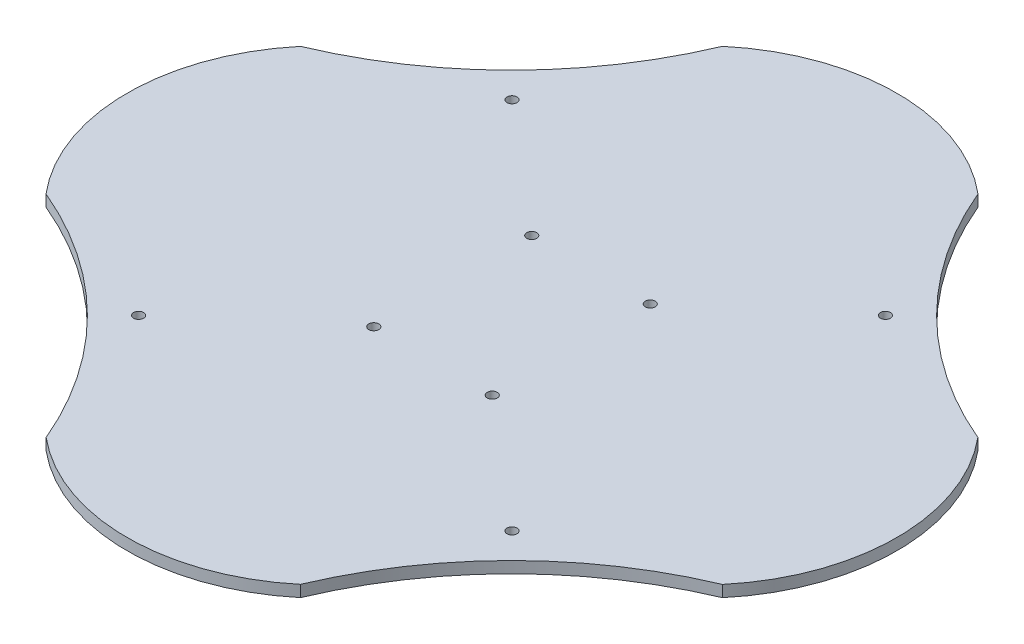
from build123d import *

# Parameters (mm, degrees)
SKETCH_2_R          = 1.52
EXTRUDE_3_DEPTH     = 3.5
SKETCH_4_R          = 1.52
CUT_EXTRUDE_2_DEPTH = 59


with BuildPart() as part:
    # 草图2 → 凸台-拉伸3 (new body)
    with BuildSketch(Plane(origin=(0, 0, 0), x_dir=(1, 0, 0), z_dir=(0, 1, 0))):
        with BuildLine():
            ThreePointArc((52.825076068, 9.426208049), (14.498253114, 35.198189312), (-11.256015981, 73.536916461))
            ThreePointArc((-11.256015981, 73.536916461), (-50.087090727, 87.727594053), (-88.918165473, 73.536916461))
            ThreePointArc((-88.918165473, 73.536916461), (-114.672434568, 35.198189312), (-152.999257522, 9.426208049))
            ThreePointArc((-152.999257522, 9.426208049), (-167.03419139, -29.340594642), (-152.843635286, -68.050702844))
            ThreePointArc((-152.843635286, -68.050702844), (-114.504908137, -93.804971939), (-88.732926874, -132.131794893))
            ThreePointArc((-88.732926874, -132.131794893), (-50.087090727, -146.166850249), (-11.44125458, -132.131794893))
            ThreePointArc((-11.44125458, -132.131794893), (14.330726683, -93.804971939), (52.669453832, -68.050702844))
            ThreePointArc((52.669453832, -68.050702844), (66.860009936, -29.340594642), (52.825076068, 9.426208049))
        make_face()
        with Locations((6.636520349, 27.503982978)):
            Circle(SKETCH_2_R, mode=Mode.SUBTRACT)
        with Locations((6.636520349, -85.943239174)):
            Circle(SKETCH_2_R, mode=Mode.SUBTRACT)
        with BuildLine():
            ThreePointArc((10.04025671, -89.346975535), (10.040052916, -89.350573664), (10.039848907, -89.354171782))
            Line((10.039848907, -89.354171782), (10.033073973, -89.34738171))
            ThreePointArc((10.033073973, -89.34738171), (10.036665347, -89.34717873), (10.04025671, -89.346975535))
        make_face(mode=Mode.SUBTRACT)
        with Locations((-106.810701803, 27.503982978)):
            Circle(SKETCH_2_R, mode=Mode.SUBTRACT)
        with Locations((-106.810701803, -85.943239174)):
            Circle(SKETCH_2_R, mode=Mode.SUBTRACT)
    extrude(amount=EXTRUDE_3_DEPTH)

    # 草图4 → 切除-拉伸2 (cut)
    with BuildSketch(Plane.XZ.offset(-7.25)):
        with Locations((-68.087090727, 5.219628098)):
            Circle(SKETCH_4_R)
        with Locations((-32.087090727, 5.219628098)):
            Circle(SKETCH_4_R)
        with Locations((-68.087090727, 53.219628098)):
            Circle(SKETCH_4_R)
        with Locations((-32.087090727, 53.219628098)):
            Circle(SKETCH_4_R)
    extrude(amount=CUT_EXTRUDE_2_DEPTH, mode=Mode.SUBTRACT)


solid = part.part
